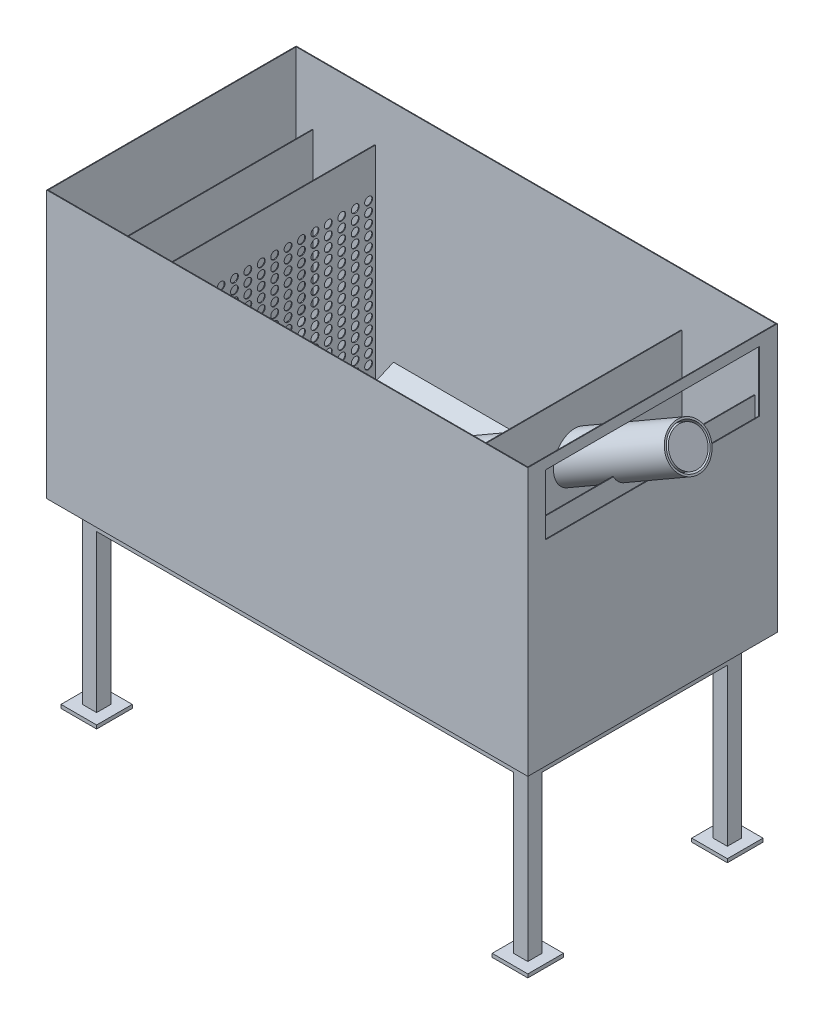
from build123d import *

# Parameters (mm, degrees)
MASTER_FOOTPRINT_W                    = 1350
MASTER_FOOTPRINT_H                    = 700
BATH_BASE_PLATE_DEPTH                 = 750
BATH_SHELL_2MM_T                      = -2
SKETCH_1_R                            = 50
INLET_D100_OPENING_DEPTH              = 10
INLET_IMPACT_BAFFLE_START             = 125
SKETCH_2_W                            = 540
SKETCH_2_H                            = 430
INLET_IMPACT_BAFFLE_DEPTH             = 2
DISTRIBUTOR_D22_START                 = 250
SKETCH_3_W                            = 640
SKETCH_3_H                            = 648
SKETCH_3_R                            = 11
DISTRIBUTOR_D22_DEPTH                 = 2
OUTLET_SUBMERGED_BAFFLE_START         = 1130
SKETCH_4_W                            = 600
SKETCH_4_H                            = 330
OUTLET_SUBMERGED_BAFFLE_DEPTH         = 2
OVERFLOW_WEIR_Z550_START              = 1290
SKETCH_5_W                            = 690
SKETCH_5_H                            = 548
OVERFLOW_WEIR_Z550_DEPTH              = 2
OUTLET_WEIR_SLOT_W600_START           = 1345
SKETCH_6_W                            = 600
SKETCH_6_H                            = 170
OUTLET_WEIR_SLOT_W600_DEPTH           = 10
SLOPED_SEDIMENT_FLOOR_START           = 275
SLOPED_SEDIMENT_FLOOR_DEPTH           = 825
SKETCH_8_W                            = 40
SKETCH_8_H                            = 40
FRAME_LEGS_40X40_H500_DEPTH           = 500
FRAME_LONGITUDINAL_RAILS_START        = -20
SKETCH_9_W                            = 1250
SKETCH_9_H                            = 40
FRAME_LONGITUDINAL_RAILS_DEPTH        = 40
FRAME_TRANSVERSE_RAILS_START          = -20
SKETCH_10_W                           = 40
SKETCH_10_H                           = 520
FRAME_TRANSVERSE_RAILS_DEPTH          = 40
FRAME_FOOT_PADS_100X100_START         = -500
SKETCH_11_W                           = 100
SKETCH_11_H                           = 100
FRAME_FOOT_PADS_100X100_DEPTH         = 10
SEALED_SCREW_PASSAGE_D120_PROFILE_R   = 60
SCREW_CASING_THIN_D110_T5_PROFILE_R   = 60
SCREW_CASING_THIN_D110_T5_PROFILE_R_2 = 55
SCREW_OUTER_ENVELOPE_D100_PROFILE_R   = 50


with BuildPart() as part:
    # MASTER_FOOTPRINT → BATH_BASE_PLATE (new body)
    with BuildSketch(Plane(origin=(0, 0, 0), x_dir=(1, 0, 0), z_dir=(0, 1, 0))):
        with Locations((675, 350)):
            Rectangle(MASTER_FOOTPRINT_W, MASTER_FOOTPRINT_H)
    extrude(amount=BATH_BASE_PLATE_DEPTH)

    # BATH_SHELL_2MM
    bath_shell_2mm_openings = [part.faces().sort_by_distance(p)[0] for p in [
        (675, 750, -350),
    ]]
    offset(amount=BATH_SHELL_2MM_T, openings=bath_shell_2mm_openings, kind=Kind.INTERSECTION)

    # Эскиз1 → INLET_D100_OPENING (cut)
    with BuildSketch(Plane(origin=(0, 0, 0), x_dir=(0, 0, -1), z_dir=(1, 0, 0))):
        with Locations((350, 420)):
            Circle(SKETCH_1_R)
    extrude(amount=INLET_D100_OPENING_DEPTH, mode=Mode.SUBTRACT)

    # Эскиз6 → OUTLET_WEIR_SLOT_W600 (cut)
    with BuildSketch(Plane(origin=(0, 0, 0), x_dir=(0, 0, -1), z_dir=(1, 0, 0)).offset(OUTLET_WEIR_SLOT_W600_START)):
        with Locations((350, 635)):
            Rectangle(SKETCH_6_W, SKETCH_6_H)
    extrude(amount=OUTLET_WEIR_SLOT_W600_DEPTH, mode=Mode.SUBTRACT)

    # Эскиз7 → SLOPED_SEDIMENT_FLOOR (add)
    with BuildSketch(Plane(origin=(0, 0, 0), x_dir=(0, 0, -1), z_dir=(1, 0, 0)).offset(SLOPED_SEDIMENT_FLOOR_START)):
        Polygon((2, -1), (2, 120), (280, -1), align=None)
        Polygon((698, -1), (698, 120), (420, -1), align=None)
    extrude(amount=SLOPED_SEDIMENT_FLOOR_DEPTH)

    # Эскиз8 → FRAME_LEGS_40X40_H500 (add)
    with BuildSketch(Plane(origin=(0, 0, 0), x_dir=(1, 0, 0), z_dir=(0, 1, 0))):
        with Locations((70, 70)):
            Rectangle(SKETCH_8_W, SKETCH_8_H)
        with Locations((70, 630)):
            Rectangle(SKETCH_8_W, SKETCH_8_H)
        with Locations((1280, 70)):
            Rectangle(SKETCH_8_W, SKETCH_8_H)
        with Locations((1280, 630)):
            Rectangle(SKETCH_8_W, SKETCH_8_H)
    extrude(amount=-FRAME_LEGS_40X40_H500_DEPTH)

    # Эскиз9 → FRAME_LONGITUDINAL_RAILS (add)
    with BuildSketch(Plane(origin=(0, 0, 0), x_dir=(1, 0, 0), z_dir=(0, 1, 0)).offset(FRAME_LONGITUDINAL_RAILS_START)):
        with Locations((675, 70)):
            Rectangle(SKETCH_9_W, SKETCH_9_H)
        with Locations((675, 630)):
            Rectangle(SKETCH_9_W, SKETCH_9_H)
    extrude(amount=-FRAME_LONGITUDINAL_RAILS_DEPTH)

    # Эскиз10 → FRAME_TRANSVERSE_RAILS (add)
    with BuildSketch(Plane(origin=(0, 0, 0), x_dir=(1, 0, 0), z_dir=(0, 1, 0)).offset(FRAME_TRANSVERSE_RAILS_START)):
        with Locations((70, 350)):
            Rectangle(SKETCH_10_W, SKETCH_10_H)
        with Locations((1280, 350)):
            Rectangle(SKETCH_10_W, SKETCH_10_H)
    extrude(amount=-FRAME_TRANSVERSE_RAILS_DEPTH)

    # Эскиз11 → FRAME_FOOT_PADS_100X100 (add)
    with BuildSketch(Plane(origin=(0, 0, 0), x_dir=(1, 0, 0), z_dir=(0, 1, 0)).offset(FRAME_FOOT_PADS_100X100_START)):
        with Locations((70, 70)):
            Rectangle(SKETCH_11_W, SKETCH_11_H)
        with Locations((70, 630)):
            Rectangle(SKETCH_11_W, SKETCH_11_H)
        with Locations((1280, 70)):
            Rectangle(SKETCH_11_W, SKETCH_11_H)
        with Locations((1280, 630)):
            Rectangle(SKETCH_11_W, SKETCH_11_H)
    extrude(amount=-FRAME_FOOT_PADS_100X100_DEPTH)


with BuildPart() as body_2:
    # Эскиз2 → INLET_IMPACT_BAFFLE (new body)
    with BuildSketch(Plane(origin=(0, 0, 0), x_dir=(0, 0, -1), z_dir=(1, 0, 0)).offset(INLET_IMPACT_BAFFLE_START)):
        with Locations((350, 435)):
            Rectangle(SKETCH_2_W, SKETCH_2_H)
    extrude(amount=INLET_IMPACT_BAFFLE_DEPTH)


with BuildPart() as body_3:
    # Эскиз3 → DISTRIBUTOR_D22 (new body)
    with BuildSketch(Plane(origin=(0, 0, 0), x_dir=(0, 0, -1), z_dir=(1, 0, 0)).offset(DISTRIBUTOR_D22_START)):
        with Locations((350, 326)):
            Rectangle(SKETCH_3_W, SKETCH_3_H)
        with Locations((48.823529412, 125)):
            Circle(SKETCH_3_R, mode=Mode.SUBTRACT)
        with Locations((48.823529412, 153.5)):
            Circle(SKETCH_3_R, mode=Mode.SUBTRACT)
        with Locations((48.823529412, 182)):
            Circle(SKETCH_3_R, mode=Mode.SUBTRACT)
        with Locations((48.823529412, 210.5)):
            Circle(SKETCH_3_R, mode=Mode.SUBTRACT)
        with Locations((48.823529412, 239)):
            Circle(SKETCH_3_R, mode=Mode.SUBTRACT)
        with Locations((48.823529412, 267.5)):
            Circle(SKETCH_3_R, mode=Mode.SUBTRACT)
        with Locations((48.823529412, 296)):
            Circle(SKETCH_3_R, mode=Mode.SUBTRACT)
        with Locations((48.823529412, 324.5)):
            Circle(SKETCH_3_R, mode=Mode.SUBTRACT)
        with Locations((48.823529412, 353)):
            Circle(SKETCH_3_R, mode=Mode.SUBTRACT)
        with Locations((48.823529412, 381.5)):
            Circle(SKETCH_3_R, mode=Mode.SUBTRACT)
        with Locations((48.823529412, 410)):
            Circle(SKETCH_3_R, mode=Mode.SUBTRACT)
        with Locations((48.823529412, 438.5)):
            Circle(SKETCH_3_R, mode=Mode.SUBTRACT)
        with Locations((48.823529412, 467)):
            Circle(SKETCH_3_R, mode=Mode.SUBTRACT)
        with Locations((48.823529412, 495.5)):
            Circle(SKETCH_3_R, mode=Mode.SUBTRACT)
        with Locations((48.823529412, 524)):
            Circle(SKETCH_3_R, mode=Mode.SUBTRACT)
        with Locations((86.470588235, 125)):
            Circle(SKETCH_3_R, mode=Mode.SUBTRACT)
        with Locations((86.470588235, 153.5)):
            Circle(SKETCH_3_R, mode=Mode.SUBTRACT)
        with Locations((86.470588235, 182)):
            Circle(SKETCH_3_R, mode=Mode.SUBTRACT)
        with Locations((86.470588235, 210.5)):
            Circle(SKETCH_3_R, mode=Mode.SUBTRACT)
        with Locations((86.470588235, 239)):
            Circle(SKETCH_3_R, mode=Mode.SUBTRACT)
        with Locations((86.470588235, 267.5)):
            Circle(SKETCH_3_R, mode=Mode.SUBTRACT)
        with Locations((86.470588235, 296)):
            Circle(SKETCH_3_R, mode=Mode.SUBTRACT)
        with Locations((86.470588235, 324.5)):
            Circle(SKETCH_3_R, mode=Mode.SUBTRACT)
        with Locations((86.470588235, 353)):
            Circle(SKETCH_3_R, mode=Mode.SUBTRACT)
        with Locations((86.470588235, 381.5)):
            Circle(SKETCH_3_R, mode=Mode.SUBTRACT)
        with Locations((86.470588235, 410)):
            Circle(SKETCH_3_R, mode=Mode.SUBTRACT)
        with Locations((86.470588235, 438.5)):
            Circle(SKETCH_3_R, mode=Mode.SUBTRACT)
        with Locations((86.470588235, 467)):
            Circle(SKETCH_3_R, mode=Mode.SUBTRACT)
        with Locations((86.470588235, 495.5)):
            Circle(SKETCH_3_R, mode=Mode.SUBTRACT)
        with Locations((86.470588235, 524)):
            Circle(SKETCH_3_R, mode=Mode.SUBTRACT)
        with Locations((124.117647059, 125)):
            Circle(SKETCH_3_R, mode=Mode.SUBTRACT)
        with Locations((124.117647059, 153.5)):
            Circle(SKETCH_3_R, mode=Mode.SUBTRACT)
        with Locations((124.117647059, 182)):
            Circle(SKETCH_3_R, mode=Mode.SUBTRACT)
        with Locations((124.117647059, 210.5)):
            Circle(SKETCH_3_R, mode=Mode.SUBTRACT)
        with Locations((124.117647059, 239)):
            Circle(SKETCH_3_R, mode=Mode.SUBTRACT)
        with Locations((124.117647059, 267.5)):
            Circle(SKETCH_3_R, mode=Mode.SUBTRACT)
        with Locations((124.117647059, 296)):
            Circle(SKETCH_3_R, mode=Mode.SUBTRACT)
        with Locations((124.117647059, 324.5)):
            Circle(SKETCH_3_R, mode=Mode.SUBTRACT)
        with Locations((124.117647059, 353)):
            Circle(SKETCH_3_R, mode=Mode.SUBTRACT)
        with Locations((124.117647059, 381.5)):
            Circle(SKETCH_3_R, mode=Mode.SUBTRACT)
        with Locations((124.117647059, 410)):
            Circle(SKETCH_3_R, mode=Mode.SUBTRACT)
        with Locations((124.117647059, 438.5)):
            Circle(SKETCH_3_R, mode=Mode.SUBTRACT)
        with Locations((124.117647059, 467)):
            Circle(SKETCH_3_R, mode=Mode.SUBTRACT)
        with Locations((124.117647059, 495.5)):
            Circle(SKETCH_3_R, mode=Mode.SUBTRACT)
        with Locations((124.117647059, 524)):
            Circle(SKETCH_3_R, mode=Mode.SUBTRACT)
        with Locations((161.764705882, 125)):
            Circle(SKETCH_3_R, mode=Mode.SUBTRACT)
        with Locations((161.764705882, 153.5)):
            Circle(SKETCH_3_R, mode=Mode.SUBTRACT)
        with Locations((161.764705882, 182)):
            Circle(SKETCH_3_R, mode=Mode.SUBTRACT)
        with Locations((161.764705882, 210.5)):
            Circle(SKETCH_3_R, mode=Mode.SUBTRACT)
        with Locations((161.764705882, 239)):
            Circle(SKETCH_3_R, mode=Mode.SUBTRACT)
        with Locations((161.764705882, 267.5)):
            Circle(SKETCH_3_R, mode=Mode.SUBTRACT)
        with Locations((161.764705882, 296)):
            Circle(SKETCH_3_R, mode=Mode.SUBTRACT)
        with Locations((161.764705882, 324.5)):
            Circle(SKETCH_3_R, mode=Mode.SUBTRACT)
        with Locations((161.764705882, 353)):
            Circle(SKETCH_3_R, mode=Mode.SUBTRACT)
        with Locations((161.764705882, 381.5)):
            Circle(SKETCH_3_R, mode=Mode.SUBTRACT)
        with Locations((161.764705882, 410)):
            Circle(SKETCH_3_R, mode=Mode.SUBTRACT)
        with Locations((161.764705882, 438.5)):
            Circle(SKETCH_3_R, mode=Mode.SUBTRACT)
        with Locations((161.764705882, 467)):
            Circle(SKETCH_3_R, mode=Mode.SUBTRACT)
        with Locations((161.764705882, 495.5)):
            Circle(SKETCH_3_R, mode=Mode.SUBTRACT)
        with Locations((161.764705882, 524)):
            Circle(SKETCH_3_R, mode=Mode.SUBTRACT)
        with Locations((199.411764706, 125)):
            Circle(SKETCH_3_R, mode=Mode.SUBTRACT)
        with Locations((199.411764706, 153.5)):
            Circle(SKETCH_3_R, mode=Mode.SUBTRACT)
        with Locations((199.411764706, 182)):
            Circle(SKETCH_3_R, mode=Mode.SUBTRACT)
        with Locations((199.411764706, 210.5)):
            Circle(SKETCH_3_R, mode=Mode.SUBTRACT)
        with Locations((199.411764706, 239)):
            Circle(SKETCH_3_R, mode=Mode.SUBTRACT)
        with Locations((199.411764706, 267.5)):
            Circle(SKETCH_3_R, mode=Mode.SUBTRACT)
        with Locations((199.411764706, 296)):
            Circle(SKETCH_3_R, mode=Mode.SUBTRACT)
        with Locations((199.411764706, 324.5)):
            Circle(SKETCH_3_R, mode=Mode.SUBTRACT)
        with Locations((199.411764706, 353)):
            Circle(SKETCH_3_R, mode=Mode.SUBTRACT)
        with Locations((199.411764706, 381.5)):
            Circle(SKETCH_3_R, mode=Mode.SUBTRACT)
        with Locations((199.411764706, 410)):
            Circle(SKETCH_3_R, mode=Mode.SUBTRACT)
        with Locations((199.411764706, 438.5)):
            Circle(SKETCH_3_R, mode=Mode.SUBTRACT)
        with Locations((199.411764706, 467)):
            Circle(SKETCH_3_R, mode=Mode.SUBTRACT)
        with Locations((199.411764706, 495.5)):
            Circle(SKETCH_3_R, mode=Mode.SUBTRACT)
        with Locations((199.411764706, 524)):
            Circle(SKETCH_3_R, mode=Mode.SUBTRACT)
        with Locations((237.058823529, 125)):
            Circle(SKETCH_3_R, mode=Mode.SUBTRACT)
        with Locations((237.058823529, 153.5)):
            Circle(SKETCH_3_R, mode=Mode.SUBTRACT)
        with Locations((237.058823529, 182)):
            Circle(SKETCH_3_R, mode=Mode.SUBTRACT)
        with Locations((237.058823529, 210.5)):
            Circle(SKETCH_3_R, mode=Mode.SUBTRACT)
        with Locations((237.058823529, 239)):
            Circle(SKETCH_3_R, mode=Mode.SUBTRACT)
        with Locations((237.058823529, 267.5)):
            Circle(SKETCH_3_R, mode=Mode.SUBTRACT)
        with Locations((237.058823529, 296)):
            Circle(SKETCH_3_R, mode=Mode.SUBTRACT)
        with Locations((237.058823529, 324.5)):
            Circle(SKETCH_3_R, mode=Mode.SUBTRACT)
        with Locations((237.058823529, 353)):
            Circle(SKETCH_3_R, mode=Mode.SUBTRACT)
        with Locations((237.058823529, 381.5)):
            Circle(SKETCH_3_R, mode=Mode.SUBTRACT)
        with Locations((237.058823529, 410)):
            Circle(SKETCH_3_R, mode=Mode.SUBTRACT)
        with Locations((237.058823529, 438.5)):
            Circle(SKETCH_3_R, mode=Mode.SUBTRACT)
        with Locations((237.058823529, 467)):
            Circle(SKETCH_3_R, mode=Mode.SUBTRACT)
        with Locations((237.058823529, 495.5)):
            Circle(SKETCH_3_R, mode=Mode.SUBTRACT)
        with Locations((237.058823529, 524)):
            Circle(SKETCH_3_R, mode=Mode.SUBTRACT)
        with Locations((274.705882353, 125)):
            Circle(SKETCH_3_R, mode=Mode.SUBTRACT)
        with Locations((274.705882353, 153.5)):
            Circle(SKETCH_3_R, mode=Mode.SUBTRACT)
        with Locations((274.705882353, 182)):
            Circle(SKETCH_3_R, mode=Mode.SUBTRACT)
        with Locations((274.705882353, 210.5)):
            Circle(SKETCH_3_R, mode=Mode.SUBTRACT)
        with Locations((274.705882353, 239)):
            Circle(SKETCH_3_R, mode=Mode.SUBTRACT)
        with Locations((274.705882353, 267.5)):
            Circle(SKETCH_3_R, mode=Mode.SUBTRACT)
        with Locations((274.705882353, 296)):
            Circle(SKETCH_3_R, mode=Mode.SUBTRACT)
        with Locations((274.705882353, 324.5)):
            Circle(SKETCH_3_R, mode=Mode.SUBTRACT)
        with Locations((274.705882353, 353)):
            Circle(SKETCH_3_R, mode=Mode.SUBTRACT)
        with Locations((274.705882353, 381.5)):
            Circle(SKETCH_3_R, mode=Mode.SUBTRACT)
        with Locations((274.705882353, 410)):
            Circle(SKETCH_3_R, mode=Mode.SUBTRACT)
        with Locations((274.705882353, 438.5)):
            Circle(SKETCH_3_R, mode=Mode.SUBTRACT)
        with Locations((274.705882353, 467)):
            Circle(SKETCH_3_R, mode=Mode.SUBTRACT)
        with Locations((274.705882353, 495.5)):
            Circle(SKETCH_3_R, mode=Mode.SUBTRACT)
        with Locations((274.705882353, 524)):
            Circle(SKETCH_3_R, mode=Mode.SUBTRACT)
        with Locations((312.352941176, 125)):
            Circle(SKETCH_3_R, mode=Mode.SUBTRACT)
        with Locations((312.352941176, 153.5)):
            Circle(SKETCH_3_R, mode=Mode.SUBTRACT)
        with Locations((312.352941176, 182)):
            Circle(SKETCH_3_R, mode=Mode.SUBTRACT)
        with Locations((312.352941176, 210.5)):
            Circle(SKETCH_3_R, mode=Mode.SUBTRACT)
        with Locations((312.352941176, 239)):
            Circle(SKETCH_3_R, mode=Mode.SUBTRACT)
        with Locations((312.352941176, 267.5)):
            Circle(SKETCH_3_R, mode=Mode.SUBTRACT)
        with Locations((312.352941176, 296)):
            Circle(SKETCH_3_R, mode=Mode.SUBTRACT)
        with Locations((312.352941176, 324.5)):
            Circle(SKETCH_3_R, mode=Mode.SUBTRACT)
        with Locations((312.352941176, 353)):
            Circle(SKETCH_3_R, mode=Mode.SUBTRACT)
        with Locations((312.352941176, 381.5)):
            Circle(SKETCH_3_R, mode=Mode.SUBTRACT)
        with Locations((312.352941176, 410)):
            Circle(SKETCH_3_R, mode=Mode.SUBTRACT)
        with Locations((312.352941176, 438.5)):
            Circle(SKETCH_3_R, mode=Mode.SUBTRACT)
        with Locations((312.352941176, 467)):
            Circle(SKETCH_3_R, mode=Mode.SUBTRACT)
        with Locations((312.352941176, 495.5)):
            Circle(SKETCH_3_R, mode=Mode.SUBTRACT)
        with Locations((312.352941176, 524)):
            Circle(SKETCH_3_R, mode=Mode.SUBTRACT)
        with Locations((350, 125)):
            Circle(SKETCH_3_R, mode=Mode.SUBTRACT)
        with Locations((350, 153.5)):
            Circle(SKETCH_3_R, mode=Mode.SUBTRACT)
        with Locations((350, 182)):
            Circle(SKETCH_3_R, mode=Mode.SUBTRACT)
        with Locations((350, 210.5)):
            Circle(SKETCH_3_R, mode=Mode.SUBTRACT)
        with Locations((350, 239)):
            Circle(SKETCH_3_R, mode=Mode.SUBTRACT)
        with Locations((350, 267.5)):
            Circle(SKETCH_3_R, mode=Mode.SUBTRACT)
        with Locations((350, 296)):
            Circle(SKETCH_3_R, mode=Mode.SUBTRACT)
        with Locations((350, 324.5)):
            Circle(SKETCH_3_R, mode=Mode.SUBTRACT)
        with Locations((350, 353)):
            Circle(SKETCH_3_R, mode=Mode.SUBTRACT)
        with Locations((350, 381.5)):
            Circle(SKETCH_3_R, mode=Mode.SUBTRACT)
        with Locations((350, 410)):
            Circle(SKETCH_3_R, mode=Mode.SUBTRACT)
        with Locations((350, 438.5)):
            Circle(SKETCH_3_R, mode=Mode.SUBTRACT)
        with Locations((350, 467)):
            Circle(SKETCH_3_R, mode=Mode.SUBTRACT)
        with Locations((350, 495.5)):
            Circle(SKETCH_3_R, mode=Mode.SUBTRACT)
        with Locations((350, 524)):
            Circle(SKETCH_3_R, mode=Mode.SUBTRACT)
        with Locations((387.647058824, 125)):
            Circle(SKETCH_3_R, mode=Mode.SUBTRACT)
        with Locations((387.647058824, 153.5)):
            Circle(SKETCH_3_R, mode=Mode.SUBTRACT)
        with Locations((387.647058824, 182)):
            Circle(SKETCH_3_R, mode=Mode.SUBTRACT)
        with Locations((387.647058824, 210.5)):
            Circle(SKETCH_3_R, mode=Mode.SUBTRACT)
        with Locations((387.647058824, 239)):
            Circle(SKETCH_3_R, mode=Mode.SUBTRACT)
        with Locations((387.647058824, 267.5)):
            Circle(SKETCH_3_R, mode=Mode.SUBTRACT)
        with Locations((387.647058824, 296)):
            Circle(SKETCH_3_R, mode=Mode.SUBTRACT)
        with Locations((387.647058824, 324.5)):
            Circle(SKETCH_3_R, mode=Mode.SUBTRACT)
        with Locations((387.647058824, 353)):
            Circle(SKETCH_3_R, mode=Mode.SUBTRACT)
        with Locations((387.647058824, 381.5)):
            Circle(SKETCH_3_R, mode=Mode.SUBTRACT)
        with Locations((387.647058824, 410)):
            Circle(SKETCH_3_R, mode=Mode.SUBTRACT)
        with Locations((387.647058824, 438.5)):
            Circle(SKETCH_3_R, mode=Mode.SUBTRACT)
        with Locations((387.647058824, 467)):
            Circle(SKETCH_3_R, mode=Mode.SUBTRACT)
        with Locations((387.647058824, 495.5)):
            Circle(SKETCH_3_R, mode=Mode.SUBTRACT)
        with Locations((387.647058824, 524)):
            Circle(SKETCH_3_R, mode=Mode.SUBTRACT)
        with Locations((425.294117647, 125)):
            Circle(SKETCH_3_R, mode=Mode.SUBTRACT)
        with Locations((425.294117647, 153.5)):
            Circle(SKETCH_3_R, mode=Mode.SUBTRACT)
        with Locations((425.294117647, 182)):
            Circle(SKETCH_3_R, mode=Mode.SUBTRACT)
        with Locations((425.294117647, 210.5)):
            Circle(SKETCH_3_R, mode=Mode.SUBTRACT)
        with Locations((425.294117647, 239)):
            Circle(SKETCH_3_R, mode=Mode.SUBTRACT)
        with Locations((425.294117647, 267.5)):
            Circle(SKETCH_3_R, mode=Mode.SUBTRACT)
        with Locations((425.294117647, 296)):
            Circle(SKETCH_3_R, mode=Mode.SUBTRACT)
        with Locations((425.294117647, 324.5)):
            Circle(SKETCH_3_R, mode=Mode.SUBTRACT)
        with Locations((425.294117647, 353)):
            Circle(SKETCH_3_R, mode=Mode.SUBTRACT)
        with Locations((425.294117647, 381.5)):
            Circle(SKETCH_3_R, mode=Mode.SUBTRACT)
        with Locations((425.294117647, 410)):
            Circle(SKETCH_3_R, mode=Mode.SUBTRACT)
        with Locations((425.294117647, 438.5)):
            Circle(SKETCH_3_R, mode=Mode.SUBTRACT)
        with Locations((425.294117647, 467)):
            Circle(SKETCH_3_R, mode=Mode.SUBTRACT)
        with Locations((425.294117647, 495.5)):
            Circle(SKETCH_3_R, mode=Mode.SUBTRACT)
        with Locations((425.294117647, 524)):
            Circle(SKETCH_3_R, mode=Mode.SUBTRACT)
        with Locations((462.941176471, 125)):
            Circle(SKETCH_3_R, mode=Mode.SUBTRACT)
        with Locations((462.941176471, 153.5)):
            Circle(SKETCH_3_R, mode=Mode.SUBTRACT)
        with Locations((462.941176471, 182)):
            Circle(SKETCH_3_R, mode=Mode.SUBTRACT)
        with Locations((462.941176471, 210.5)):
            Circle(SKETCH_3_R, mode=Mode.SUBTRACT)
        with Locations((462.941176471, 239)):
            Circle(SKETCH_3_R, mode=Mode.SUBTRACT)
        with Locations((462.941176471, 267.5)):
            Circle(SKETCH_3_R, mode=Mode.SUBTRACT)
        with Locations((462.941176471, 296)):
            Circle(SKETCH_3_R, mode=Mode.SUBTRACT)
        with Locations((462.941176471, 324.5)):
            Circle(SKETCH_3_R, mode=Mode.SUBTRACT)
        with Locations((462.941176471, 353)):
            Circle(SKETCH_3_R, mode=Mode.SUBTRACT)
        with Locations((462.941176471, 381.5)):
            Circle(SKETCH_3_R, mode=Mode.SUBTRACT)
        with Locations((462.941176471, 410)):
            Circle(SKETCH_3_R, mode=Mode.SUBTRACT)
        with Locations((462.941176471, 438.5)):
            Circle(SKETCH_3_R, mode=Mode.SUBTRACT)
        with Locations((462.941176471, 467)):
            Circle(SKETCH_3_R, mode=Mode.SUBTRACT)
        with Locations((462.941176471, 495.5)):
            Circle(SKETCH_3_R, mode=Mode.SUBTRACT)
        with Locations((462.941176471, 524)):
            Circle(SKETCH_3_R, mode=Mode.SUBTRACT)
        with Locations((500.588235294, 125)):
            Circle(SKETCH_3_R, mode=Mode.SUBTRACT)
        with Locations((500.588235294, 153.5)):
            Circle(SKETCH_3_R, mode=Mode.SUBTRACT)
        with Locations((500.588235294, 182)):
            Circle(SKETCH_3_R, mode=Mode.SUBTRACT)
        with Locations((500.588235294, 210.5)):
            Circle(SKETCH_3_R, mode=Mode.SUBTRACT)
        with Locations((500.588235294, 239)):
            Circle(SKETCH_3_R, mode=Mode.SUBTRACT)
        with Locations((500.588235294, 267.5)):
            Circle(SKETCH_3_R, mode=Mode.SUBTRACT)
        with Locations((500.588235294, 296)):
            Circle(SKETCH_3_R, mode=Mode.SUBTRACT)
        with Locations((500.588235294, 324.5)):
            Circle(SKETCH_3_R, mode=Mode.SUBTRACT)
        with Locations((500.588235294, 353)):
            Circle(SKETCH_3_R, mode=Mode.SUBTRACT)
        with Locations((500.588235294, 381.5)):
            Circle(SKETCH_3_R, mode=Mode.SUBTRACT)
        with Locations((500.588235294, 410)):
            Circle(SKETCH_3_R, mode=Mode.SUBTRACT)
        with Locations((500.588235294, 438.5)):
            Circle(SKETCH_3_R, mode=Mode.SUBTRACT)
        with Locations((500.588235294, 467)):
            Circle(SKETCH_3_R, mode=Mode.SUBTRACT)
        with Locations((500.588235294, 495.5)):
            Circle(SKETCH_3_R, mode=Mode.SUBTRACT)
        with Locations((500.588235294, 524)):
            Circle(SKETCH_3_R, mode=Mode.SUBTRACT)
        with Locations((538.235294118, 125)):
            Circle(SKETCH_3_R, mode=Mode.SUBTRACT)
        with Locations((538.235294118, 153.5)):
            Circle(SKETCH_3_R, mode=Mode.SUBTRACT)
        with Locations((538.235294118, 182)):
            Circle(SKETCH_3_R, mode=Mode.SUBTRACT)
        with Locations((538.235294118, 210.5)):
            Circle(SKETCH_3_R, mode=Mode.SUBTRACT)
        with Locations((538.235294118, 239)):
            Circle(SKETCH_3_R, mode=Mode.SUBTRACT)
        with Locations((538.235294118, 267.5)):
            Circle(SKETCH_3_R, mode=Mode.SUBTRACT)
        with Locations((538.235294118, 296)):
            Circle(SKETCH_3_R, mode=Mode.SUBTRACT)
        with Locations((538.235294118, 324.5)):
            Circle(SKETCH_3_R, mode=Mode.SUBTRACT)
        with Locations((538.235294118, 353)):
            Circle(SKETCH_3_R, mode=Mode.SUBTRACT)
        with Locations((538.235294118, 381.5)):
            Circle(SKETCH_3_R, mode=Mode.SUBTRACT)
        with Locations((538.235294118, 410)):
            Circle(SKETCH_3_R, mode=Mode.SUBTRACT)
        with Locations((538.235294118, 438.5)):
            Circle(SKETCH_3_R, mode=Mode.SUBTRACT)
        with Locations((538.235294118, 467)):
            Circle(SKETCH_3_R, mode=Mode.SUBTRACT)
        with Locations((538.235294118, 495.5)):
            Circle(SKETCH_3_R, mode=Mode.SUBTRACT)
        with Locations((538.235294118, 524)):
            Circle(SKETCH_3_R, mode=Mode.SUBTRACT)
        with Locations((575.882352941, 125)):
            Circle(SKETCH_3_R, mode=Mode.SUBTRACT)
        with Locations((575.882352941, 153.5)):
            Circle(SKETCH_3_R, mode=Mode.SUBTRACT)
        with Locations((575.882352941, 182)):
            Circle(SKETCH_3_R, mode=Mode.SUBTRACT)
        with Locations((575.882352941, 210.5)):
            Circle(SKETCH_3_R, mode=Mode.SUBTRACT)
        with Locations((575.882352941, 239)):
            Circle(SKETCH_3_R, mode=Mode.SUBTRACT)
        with Locations((575.882352941, 267.5)):
            Circle(SKETCH_3_R, mode=Mode.SUBTRACT)
        with Locations((575.882352941, 296)):
            Circle(SKETCH_3_R, mode=Mode.SUBTRACT)
        with Locations((575.882352941, 324.5)):
            Circle(SKETCH_3_R, mode=Mode.SUBTRACT)
        with Locations((575.882352941, 353)):
            Circle(SKETCH_3_R, mode=Mode.SUBTRACT)
        with Locations((575.882352941, 381.5)):
            Circle(SKETCH_3_R, mode=Mode.SUBTRACT)
        with Locations((575.882352941, 410)):
            Circle(SKETCH_3_R, mode=Mode.SUBTRACT)
        with Locations((575.882352941, 438.5)):
            Circle(SKETCH_3_R, mode=Mode.SUBTRACT)
        with Locations((575.882352941, 467)):
            Circle(SKETCH_3_R, mode=Mode.SUBTRACT)
        with Locations((575.882352941, 495.5)):
            Circle(SKETCH_3_R, mode=Mode.SUBTRACT)
        with Locations((575.882352941, 524)):
            Circle(SKETCH_3_R, mode=Mode.SUBTRACT)
        with Locations((613.529411765, 125)):
            Circle(SKETCH_3_R, mode=Mode.SUBTRACT)
        with Locations((613.529411765, 153.5)):
            Circle(SKETCH_3_R, mode=Mode.SUBTRACT)
        with Locations((613.529411765, 182)):
            Circle(SKETCH_3_R, mode=Mode.SUBTRACT)
        with Locations((613.529411765, 210.5)):
            Circle(SKETCH_3_R, mode=Mode.SUBTRACT)
        with Locations((613.529411765, 239)):
            Circle(SKETCH_3_R, mode=Mode.SUBTRACT)
        with Locations((613.529411765, 267.5)):
            Circle(SKETCH_3_R, mode=Mode.SUBTRACT)
        with Locations((613.529411765, 296)):
            Circle(SKETCH_3_R, mode=Mode.SUBTRACT)
        with Locations((613.529411765, 324.5)):
            Circle(SKETCH_3_R, mode=Mode.SUBTRACT)
        with Locations((613.529411765, 353)):
            Circle(SKETCH_3_R, mode=Mode.SUBTRACT)
        with Locations((613.529411765, 381.5)):
            Circle(SKETCH_3_R, mode=Mode.SUBTRACT)
        with Locations((613.529411765, 410)):
            Circle(SKETCH_3_R, mode=Mode.SUBTRACT)
        with Locations((613.529411765, 438.5)):
            Circle(SKETCH_3_R, mode=Mode.SUBTRACT)
        with Locations((613.529411765, 467)):
            Circle(SKETCH_3_R, mode=Mode.SUBTRACT)
        with Locations((613.529411765, 495.5)):
            Circle(SKETCH_3_R, mode=Mode.SUBTRACT)
        with Locations((613.529411765, 524)):
            Circle(SKETCH_3_R, mode=Mode.SUBTRACT)
        with Locations((651.176470588, 125)):
            Circle(SKETCH_3_R, mode=Mode.SUBTRACT)
        with Locations((651.176470588, 153.5)):
            Circle(SKETCH_3_R, mode=Mode.SUBTRACT)
        with Locations((651.176470588, 182)):
            Circle(SKETCH_3_R, mode=Mode.SUBTRACT)
        with Locations((651.176470588, 210.5)):
            Circle(SKETCH_3_R, mode=Mode.SUBTRACT)
        with Locations((651.176470588, 239)):
            Circle(SKETCH_3_R, mode=Mode.SUBTRACT)
        with Locations((651.176470588, 267.5)):
            Circle(SKETCH_3_R, mode=Mode.SUBTRACT)
        with Locations((651.176470588, 296)):
            Circle(SKETCH_3_R, mode=Mode.SUBTRACT)
        with Locations((651.176470588, 324.5)):
            Circle(SKETCH_3_R, mode=Mode.SUBTRACT)
        with Locations((651.176470588, 353)):
            Circle(SKETCH_3_R, mode=Mode.SUBTRACT)
        with Locations((651.176470588, 381.5)):
            Circle(SKETCH_3_R, mode=Mode.SUBTRACT)
        with Locations((651.176470588, 410)):
            Circle(SKETCH_3_R, mode=Mode.SUBTRACT)
        with Locations((651.176470588, 438.5)):
            Circle(SKETCH_3_R, mode=Mode.SUBTRACT)
        with Locations((651.176470588, 467)):
            Circle(SKETCH_3_R, mode=Mode.SUBTRACT)
        with Locations((651.176470588, 495.5)):
            Circle(SKETCH_3_R, mode=Mode.SUBTRACT)
        with Locations((651.176470588, 524)):
            Circle(SKETCH_3_R, mode=Mode.SUBTRACT)
    extrude(amount=DISTRIBUTOR_D22_DEPTH)


with BuildPart() as body_4:
    # Эскиз4 → OUTLET_SUBMERGED_BAFFLE (new body)
    with BuildSketch(Plane(origin=(0, 0, 0), x_dir=(0, 0, -1), z_dir=(1, 0, 0)).offset(OUTLET_SUBMERGED_BAFFLE_START)):
        with Locations((350, 485)):
            Rectangle(SKETCH_4_W, SKETCH_4_H)
    extrude(amount=OUTLET_SUBMERGED_BAFFLE_DEPTH)


with BuildPart() as body_5:
    # Эскиз5 → OVERFLOW_WEIR_Z550 (new body)
    with BuildSketch(Plane(origin=(0, 0, 0), x_dir=(0, 0, -1), z_dir=(1, 0, 0)).offset(OVERFLOW_WEIR_Z550_START)):
        with Locations((350, 276)):
            Rectangle(SKETCH_5_W, SKETCH_5_H)
    extrude(amount=OVERFLOW_WEIR_Z550_DEPTH)


with BuildPart() as sealed_screw_passage_d120_tool:
    # SEALED_SCREW_PASSAGE_D120: sweep along a curve in space
    with BuildLine() as sealed_screw_passage_d120_path:
        Line((400, 70, -350), (1450, 676.217782649, -350))
    # SEALED_SCREW_PASSAGE_D120 profile (on start of the path) → SEALED_SCREW_PASSAGE_D120 (sweep)
    with BuildSketch(Plane(origin=(400, 70, -350), x_dir=(-0.5, 0.8660254037844387, 0), z_dir=(0.8660254037844387, 0.5, 0))):
        Circle(SEALED_SCREW_PASSAGE_D120_PROFILE_R)
    sweep(path=sealed_screw_passage_d120_path.line)


with BuildPart() as part_1:
    add(part.part)

    # SEALED_SCREW_PASSAGE_D120: cut by sealed_screw_passage_d120_tool
    add(sealed_screw_passage_d120_tool.part, mode=Mode.SUBTRACT)


with BuildPart() as body_4_1:
    add(body_4.part)

    # SEALED_SCREW_PASSAGE_D120: cut by sealed_screw_passage_d120_tool
    add(sealed_screw_passage_d120_tool.part, mode=Mode.SUBTRACT)


with BuildPart() as body_5_1:
    add(body_5.part)

    # SEALED_SCREW_PASSAGE_D120: cut by sealed_screw_passage_d120_tool
    add(sealed_screw_passage_d120_tool.part, mode=Mode.SUBTRACT)


with BuildPart() as body_6:
    # SCREW_CASING_THIN_D110_T5: sweep along a curve in space
    with BuildLine() as screw_casing_thin_d110_t5_path:
        Line((400, 70, -350), (1450, 676.217782649, -350))
    # SCREW_CASING_THIN_D110_T5 profile (on start of the path) → SCREW_CASING_THIN_D110_T5 (sweep)
    with BuildSketch(Plane(origin=(400, 70, -350), x_dir=(-0.5, 0.8660254037844387, 0), z_dir=(0.8660254037844387, 0.5, 0))):
        Circle(SCREW_CASING_THIN_D110_T5_PROFILE_R)
        Circle(SCREW_CASING_THIN_D110_T5_PROFILE_R_2, mode=Mode.SUBTRACT)
    sweep(path=screw_casing_thin_d110_t5_path.line, is_frenet=True)


with BuildPart() as body_7:
    # SCREW_OUTER_ENVELOPE_D100: sweep along a curve in space
    with BuildLine() as screw_outer_envelope_d100_path:
        Line((400, 70, -350), (1450, 676.217782649, -350))
    # SCREW_OUTER_ENVELOPE_D100 profile (on start of the path) → SCREW_OUTER_ENVELOPE_D100 (sweep)
    with BuildSketch(Plane(origin=(400, 70, -350), x_dir=(-0.5, 0.8660254037844387, 0), z_dir=(0.8660254037844387, 0.5, 0))):
        Circle(SCREW_OUTER_ENVELOPE_D100_PROFILE_R)
    sweep(path=screw_outer_envelope_d100_path.line)


solid = Compound([body_2.part, body_3.part, part_1.part, body_4_1.part, body_5_1.part, body_6.part, body_7.part])
